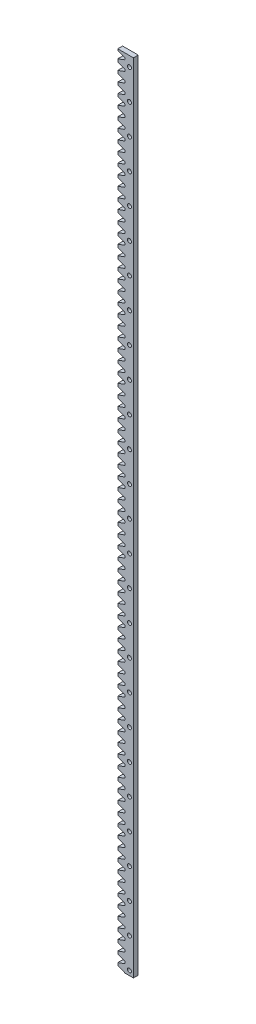
from build123d import *

# Parameters (mm, degrees)
CI_DEPTH                   = 1.5
CI_DEPTH_BACK              = 1.5
SKETCHCI_M_STRSKETCHNAME_W = 20.849999973
SKETCHCI_M_STRSKETCHNAME_H = 722.566299473
CUT_EXTRUDE_498_DEPTH      = 2.5
PATTERN_LINEAR_559_COUNT   = 115
PATTERN_LINEAR_559_PITCH   = 6.283185307
CUT_EXTRUDE_1_DEPTH        = 10
SKETCH_3_R                 = 1.25
CUT_EXTRUDE_2_DEPTH        = 496.932011654


with BuildPart() as part:
    # SketchCI.m_strSketchName → 拉伸CI (new, two sides: drawn at the far end of the back side and taken through both)
    with BuildSketch(Plane.XY.offset(-CI_DEPTH_BACK)):
        with Locations((8.625000014, -358.141557131)):
            Rectangle(SKETCHCI_M_STRSKETCHNAME_W, SKETCHCI_M_STRSKETCHNAME_H)
    extrude(amount=CI_DEPTH + CI_DEPTH_BACK)

    # Sketch 427 → Cut-Extrude 498 (cut, symmetric)
    with BuildSketch(Plane.XY):
        with BuildLine():
            Line((-1.799999973, 2.298736761), (-1.799999973, -2.298736761))
            Line((-1.799999973, -2.298736761), (2.305212051, -0.804561779))
            ThreePointArc((2.305212051, -0.804561779), (2.591491188, -0.584892071), (2.699999959, -0.240746215))
            Line((2.699999959, -0.240746215), (2.699999959, 0.240746215))
            ThreePointArc((2.699999959, 0.240746215), (2.591491188, 0.584892071), (2.305212051, 0.804561779))
            Line((2.305212051, 0.804561779), (-1.799999973, 2.298736761))
        make_face()
    cut_extrude_498 = extrude(amount=CUT_EXTRUDE_498_DEPTH, both=True, mode=Mode.SUBTRACT)

    # Pattern Linear 559: Cut-Extrude 498 ×115
    with Locations(*[(0, -i * PATTERN_LINEAR_559_PITCH, 0) for i in range(1, PATTERN_LINEAR_559_COUNT)]):
        add(cut_extrude_498, mode=Mode.SUBTRACT)

    # 草图1 → 切除-拉伸1 (cut)
    with BuildSketch(Plane.XY.offset(1.5)):
        Polygon((8, 0), (8, -495.858407394), (-4, -495.858407394), (-4, -720.424706867), (21.05, -720.424706867), (21.05, 3.141592606), (8, 3.141592606), align=None)
    extrude(amount=-CUT_EXTRUDE_1_DEPTH, mode=Mode.SUBTRACT)

    # 草图3 → 切除-拉伸2 (cut, through all)
    with BuildSketch(Plane.XY.offset(1.5)):
        with Locations((5.5, -3.141592654)):
            Circle(SKETCH_3_R)
        with Locations((5.5, -21.981592654)):
            Circle(SKETCH_3_R)
        with Locations((5.5, -40.821592654)):
            Circle(SKETCH_3_R)
        with Locations((5.5, -59.661592654)):
            Circle(SKETCH_3_R)
        with Locations((5.5, -78.501592654)):
            Circle(SKETCH_3_R)
        with Locations((5.5, -97.341592654)):
            Circle(SKETCH_3_R)
        with Locations((5.5, -116.181592654)):
            Circle(SKETCH_3_R)
        with Locations((5.5, -135.021592654)):
            Circle(SKETCH_3_R)
        with Locations((5.5, -153.861592654)):
            Circle(SKETCH_3_R)
        with Locations((5.5, -172.701592654)):
            Circle(SKETCH_3_R)
        with Locations((5.5, -191.541592654)):
            Circle(SKETCH_3_R)
        with Locations((5.5, -210.381592654)):
            Circle(SKETCH_3_R)
        with Locations((5.5, -229.221592654)):
            Circle(SKETCH_3_R)
        with Locations((5.5, -248.061592654)):
            Circle(SKETCH_3_R)
        with Locations((5.5, -266.901592654)):
            Circle(SKETCH_3_R)
        with Locations((5.5, -285.741592654)):
            Circle(SKETCH_3_R)
        with Locations((5.5, -304.581592654)):
            Circle(SKETCH_3_R)
        with Locations((5.5, -323.421592654)):
            Circle(SKETCH_3_R)
        with Locations((5.5, -342.261592654)):
            Circle(SKETCH_3_R)
        with Locations((5.5, -361.101592654)):
            Circle(SKETCH_3_R)
        with Locations((5.5, -379.941592654)):
            Circle(SKETCH_3_R)
        with Locations((5.5, -398.781592654)):
            Circle(SKETCH_3_R)
        with Locations((5.5, -417.621592654)):
            Circle(SKETCH_3_R)
        with Locations((5.5, -436.461592654)):
            Circle(SKETCH_3_R)
        with Locations((5.5, -455.301592654)):
            Circle(SKETCH_3_R)
        with Locations((5.5, -474.141592654)):
            Circle(SKETCH_3_R)
        with Locations((5.5, -492.981592654)):
            Circle(SKETCH_3_R)
    extrude(amount=-CUT_EXTRUDE_2_DEPTH, mode=Mode.SUBTRACT)


solid = part.part
